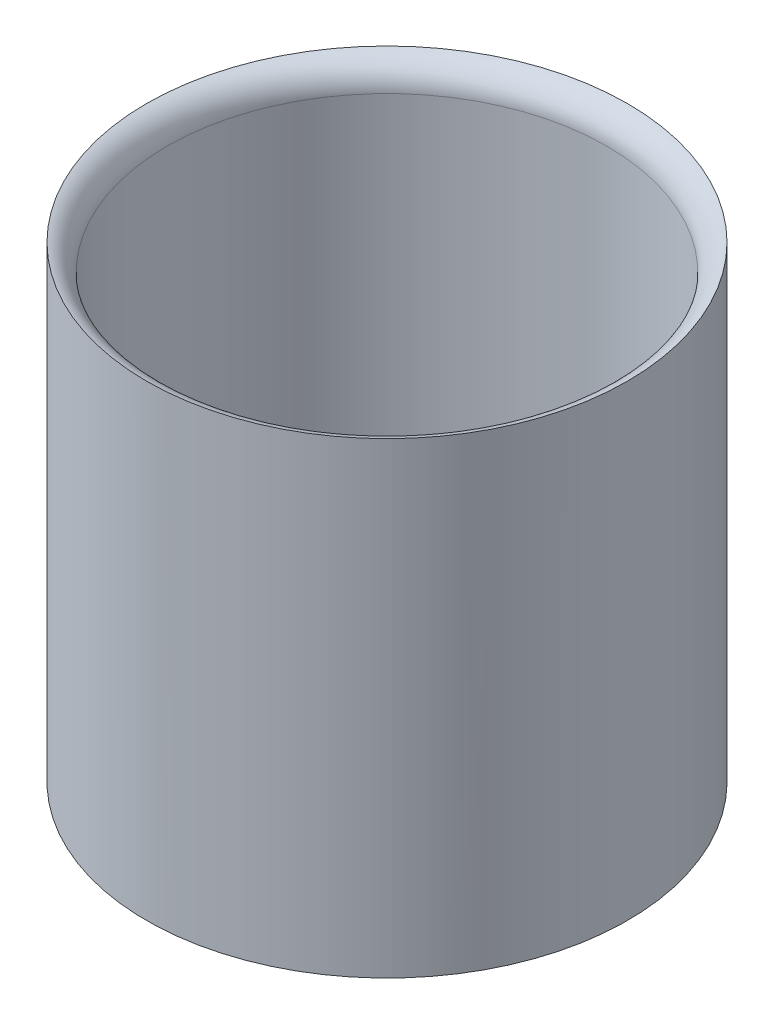
from build123d import *

# Parameters (mm, degrees)
SKETCH1_R            = 17.5
SKETCH1_R_2          = 16
BOSS_EXTRUDE1_DEPTH  = 34
SKETCH2_R            = 17.5
BOSS_EXTRUDE2_DEPTH  = 3
FILLET1_R            = 2
SKETCH3_R            = 11
BOSS_EXTRUDE3_DEPTH  = 30
CUT_EXTRUDE1_DEPTH   = 35
SKETCH6_W            = 7.99098924
SKETCH6_H            = 6.392791393
BOSS_EXTRUDE4_DEPTH  = 24
SPLIT1_OUTLINE_R     = 11
SPLIT1_DEPTH         = 33
SPLIT1_2_OUTLINE_R   = 17.5
SPLIT1_2_OUTLINE_R_2 = 11
SPLIT1_2_DEPTH       = 3
SKETCH7_R            = 17.5
SKETCH7_R_2          = 16
BOSS_EXTRUDE5_DEPTH  = 3
SKETCH8_R            = 17.5
SKETCH8_R_2          = 12.5
BOSS_EXTRUDE6_DEPTH  = 3


# Read off the part's stored shape, not the designer's step: Split1
with BuildPart() as part:
    # Sketch1 → Boss-Extrude1 (new body)
    with BuildSketch(Plane(origin=(0, 0, 0), x_dir=(1, 0, 0), z_dir=(0, 1, 0))):
        with Locations(Location((0, 0, 0), (0, 0, 270))):
            Circle(SKETCH1_R)
        with Locations(Location((0, 0, 0), (0, 0, 270))):
            Circle(SKETCH1_R_2, mode=Mode.SUBTRACT)
    extrude(amount=BOSS_EXTRUDE1_DEPTH)

    # Sketch2 → Boss-Extrude2 (add)
    with BuildSketch(Plane(origin=(0, 0, 0), x_dir=(1, 0, 0), z_dir=(0, 1, 0))):
        with Locations(Location((0, 0, 0), (0, 0, 270))):
            Circle(SKETCH2_R)
    extrude(amount=BOSS_EXTRUDE2_DEPTH)

    # Fillet1
    # the kernel refuses this fillet: 2 mm, written as the material it takes off along each edge
    with BuildSketch(Plane(origin=(0, 34, 0), x_dir=(0, 0, 1), z_dir=(-1, 0, 0))) as fillet1_piece_1:
        with BuildLine():
            CenterArc((18, -1.936491673), FILLET1_R, 104.477512186, 75.522487814)
            Line((16, -1.936491673), (15.96, -1.936491673))
            Line((15.96, -1.936491673), (15.96, 0))
            Line((15.96, 0), (16, 0.04))
            ThreePointArc((16, 0.04), (16.75, 0.04), (17.49, 0.038729833))
            Line((17.49, 0.038729833), (17.5, 0))
        make_face()
    revolve(axis=Axis((0, 34, 0), (0, 1, 0)), mode=Mode.SUBTRACT)

    # Sketch3 → Boss-Extrude3 (add)
    with BuildSketch(Plane(origin=(0, 3, 0), x_dir=(1, 0, 0), z_dir=(0, 1, 0))):
        with Locations(Location((0, 0, 0), (0, 0, 270))):
            Circle(SKETCH3_R)
    extrude(amount=BOSS_EXTRUDE3_DEPTH)

    # Sketch5 → Cut-Extrude1 (cut)
    with BuildSketch(Plane(origin=(0, 33, 0), x_dir=(1, 0, 0), z_dir=(0, 1, 0))):
        with BuildLine():
            Line((-1.077438314, 1.385334501), (1.077438314, 1.385334501))
            ThreePointArc((1.077438314, 1.385334501), (0, -1.755), (-1.077438314, 1.385334501))
        make_face()
    extrude(amount=-CUT_EXTRUDE1_DEPTH, mode=Mode.SUBTRACT)

    # Sketch6 → Boss-Extrude4 (add)
    with BuildSketch(Plane(origin=(0, 33, 0), x_dir=(1, 0, 0), z_dir=(0, 1, 0))):
        with Locations((0.014035957, -0.788514839)):
            Rectangle(SKETCH6_W, SKETCH6_H)
    extrude(amount=-BOSS_EXTRUDE4_DEPTH)

    # Split1 outline → Split1 (cut)
    with BuildSketch(Plane(origin=(0, 0, 0), x_dir=(1, 0, 0), z_dir=(0, 1, 0))):
        Circle(SPLIT1_OUTLINE_R)
    extrude(amount=SPLIT1_DEPTH, mode=Mode.SUBTRACT)

    # Split1 2 outline → Split1 2 (cut)
    with BuildSketch(Plane(origin=(0, 0, 0), x_dir=(1, 0, 0), z_dir=(0, 1, 0))):
        Circle(SPLIT1_2_OUTLINE_R)
        Circle(SPLIT1_2_OUTLINE_R_2, mode=Mode.SUBTRACT)
    extrude(amount=SPLIT1_2_DEPTH, mode=Mode.SUBTRACT)

    # Sketch7 → Boss-Extrude5 (add)
    with BuildSketch(Plane(origin=(0, 0, 0), x_dir=(-1, 0, 0), z_dir=(0, -1, 0))):
        with Locations(Location((0, 0, 0), (0, 0, 90))):
            Circle(SKETCH7_R)
        with Locations(Location((0, 0, 0), (0, 0, 90))):
            Circle(SKETCH7_R_2, mode=Mode.SUBTRACT)
    extrude(amount=-BOSS_EXTRUDE5_DEPTH)

    # Sketch8 → Boss-Extrude6 (add)
    with BuildSketch(Plane(origin=(0, 0, 0), x_dir=(-1, 0, 0), z_dir=(0, -1, 0))):
        with Locations(Location((0, 0, 0), (0, 0, 90))):
            Circle(SKETCH8_R)
        with Locations(Location((0, 0, 0), (0, 0, 90))):
            Circle(SKETCH8_R_2, mode=Mode.SUBTRACT)
    extrude(amount=-BOSS_EXTRUDE6_DEPTH)


solid = part.part
